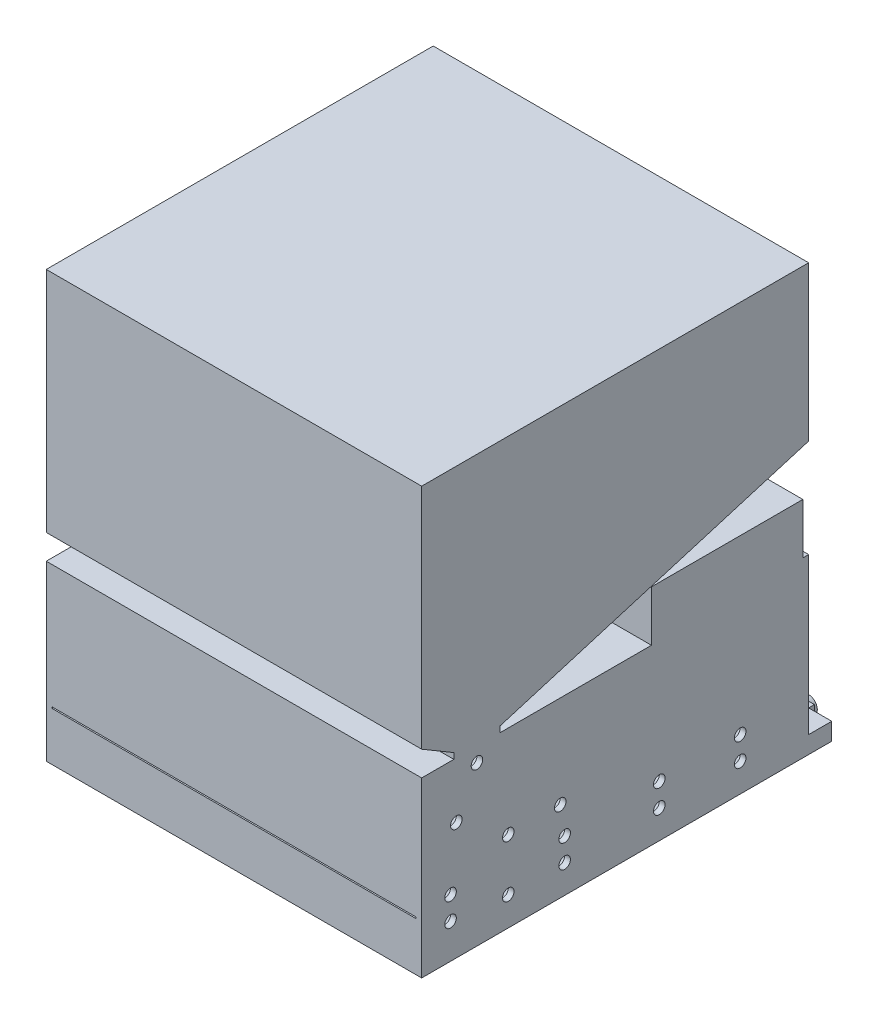
from build123d import *

# Parameters (mm, degrees)
SKETCH1_W            = 325
SKETCH1_H            = 335
BOSS_EXTRUDE1_DEPTH  = 150
SHELL3_T             = 5
CUT_EXTRUDE1_REACH   = 403.412
SKETCH2_W            = 315
SKETCH2_H            = 1.2
CUT_EXTRUDE2_REACH   = 397.198
SKETCH3_R            = 5
CUT_EXTRUDE3_REACH   = 279.421
SKETCH5_W            = 315
SKETCH5_H            = 40
BOSS_EXTRUDE2_REACH  = 393.096
BOSS_EXTRUDE17_REACH = 397.198
SHELL5_START         = -159.5
SHELL5_DEPTH         = 319
CUT_EXTRUDE6_START   = -5
SKETCH10_W           = 34.013733522
SKETCH10_H           = 3
CUT_EXTRUDE6_DEPTH   = 315
BOSS_EXTRUDE18_REACH = 521.286
BOSS_EXTRUDE21_START = -325
BOSS_EXTRUDE21_DEPTH = 325
SHELL6_START         = -159.5
SHELL6_DEPTH         = 319
SKETCH13_W           = 315
SKETCH13_H           = 61.573606594
CUT_EXTRUDE7_DEPTH   = 10
SKETCH14_W           = 325
SKETCH14_H           = 15
BOSS_EXTRUDE22_DEPTH = 20
SKETCH15_R           = 7.5
SKETCH15_R_2         = 5
BOSS_EXTRUDE23_DEPTH = 10
SKETCH16_W           = 20
SKETCH16_H           = 15
BOSS_EXTRUDE24_DEPTH = 5
SKETCH17_R           = 7.5
SKETCH17_R_2         = 5
BOSS_EXTRUDE25_DEPTH = 10
SKETCH18_W           = 20
SKETCH18_H           = 15
BOSS_EXTRUDE26_DEPTH = 5


# Read off the part's stored shape, not the designer's step: Shell5, Shell6
with BuildPart() as part:
    # Sketch1 → Boss-Extrude1 (new body)
    with BuildSketch(Plane(origin=(0, 0, 0), x_dir=(1, 0, 0), z_dir=(0, 1, 0))):
        Rectangle(SKETCH1_W, SKETCH1_H)
    extrude(amount=BOSS_EXTRUDE1_DEPTH)

    # Shell3 (no face opened: a closed hollow body)
    add(offset(amount=-SHELL3_T, mode=Mode.PRIVATE), mode=Mode.SUBTRACT)

    # Sketch2 → Cut-Extrude1 (cut, up to next)
    with BuildSketch(Plane.XY.offset(167.5), mode=Mode.PRIVATE) as cut_extrude1_sk1:
        with Locations((0, 42.7)):
            Rectangle(SKETCH2_W, SKETCH2_H)
    cut_extrude1_tool1 = extrude(cut_extrude1_sk1.sketch, amount=-CUT_EXTRUDE1_REACH, mode=Mode.PRIVATE) & part.part
    add(cut_extrude1_tool1.solids().sort_by_distance((0, 42.7, 167.5))[0], mode=Mode.SUBTRACT)

    # Cut-Extrude2: up to this face of the body (flat: up to its plane)
    cut_extrude2_end = Plane(part.part.faces().sort_by_distance((-162.5, 75, 0))[0])
    # Sketch3 → Cut-Extrude2 (cut, up to the picked face)
    with BuildSketch(Plane(origin=(162.5, 0, 0), x_dir=(0, 0, -1), z_dir=(1, 0, 0)), mode=Mode.PRIVATE) as cut_extrude2_sk1:
        with Locations((-92.5, 25)):
            Circle(SKETCH3_R)
    cut_extrude2_tool1 = split(extrude(cut_extrude2_sk1.sketch, amount=-CUT_EXTRUDE2_REACH, mode=Mode.PRIVATE), bisect_by=cut_extrude2_end, keep=Keep.BOTH, mode=Mode.PRIVATE)
    # Sketch3 → Cut-Extrude2 (cut, up to the picked face)
    with BuildSketch(Plane(origin=(162.5, 0, 0), x_dir=(0, 0, -1), z_dir=(1, 0, 0)), mode=Mode.PRIVATE) as cut_extrude2_sk2:
        with Locations((-92.5, 70)):
            Circle(SKETCH3_R)
    cut_extrude2_tool2 = split(extrude(cut_extrude2_sk2.sketch, amount=-CUT_EXTRUDE2_REACH, mode=Mode.PRIVATE), bisect_by=cut_extrude2_end, keep=Keep.BOTH, mode=Mode.PRIVATE)
    # Sketch3 → Cut-Extrude2 (cut, up to the picked face)
    with BuildSketch(Plane(origin=(162.5, 0, 0), x_dir=(0, 0, -1), z_dir=(1, 0, 0)), mode=Mode.PRIVATE) as cut_extrude2_sk3:
        with Locations((-137.5, 101.622776602)):
            Circle(SKETCH3_R)
    cut_extrude2_tool3 = split(extrude(cut_extrude2_sk3.sketch, amount=-CUT_EXTRUDE2_REACH, mode=Mode.PRIVATE), bisect_by=cut_extrude2_end, keep=Keep.BOTH, mode=Mode.PRIVATE)
    # Sketch3 → Cut-Extrude2 (cut, up to the picked face)
    with BuildSketch(Plane(origin=(162.5, 0, 0), x_dir=(0, 0, -1), z_dir=(1, 0, 0)), mode=Mode.PRIVATE) as cut_extrude2_sk4:
        with Locations((-119.658277141, 137.423236451)):
            Circle(SKETCH3_R)
    cut_extrude2_tool4 = split(extrude(cut_extrude2_sk4.sketch, amount=-CUT_EXTRUDE2_REACH, mode=Mode.PRIVATE), bisect_by=cut_extrude2_end, keep=Keep.BOTH, mode=Mode.PRIVATE)
    # Sketch3 → Cut-Extrude2 (cut, up to the picked face)
    with BuildSketch(Plane(origin=(162.5, 0, 0), x_dir=(0, 0, -1), z_dir=(1, 0, 0)), mode=Mode.PRIVATE) as cut_extrude2_sk5:
        with Locations((-47.500046324, 69.935430722)):
            Circle(SKETCH3_R)
    cut_extrude2_tool5 = split(extrude(cut_extrude2_sk5.sketch, amount=-CUT_EXTRUDE2_REACH, mode=Mode.PRIVATE), bisect_by=cut_extrude2_end, keep=Keep.BOTH, mode=Mode.PRIVATE)
    # Sketch3 → Cut-Extrude2 (cut, up to the picked face)
    with BuildSketch(Plane(origin=(162.5, 0, 0), x_dir=(0, 0, -1), z_dir=(1, 0, 0)), mode=Mode.PRIVATE) as cut_extrude2_sk6:
        with Locations((-142.5, 30)):
            Circle(SKETCH3_R)
    cut_extrude2_tool6 = split(extrude(cut_extrude2_sk6.sketch, amount=-CUT_EXTRUDE2_REACH, mode=Mode.PRIVATE), bisect_by=cut_extrude2_end, keep=Keep.BOTH, mode=Mode.PRIVATE)
    # Sketch3 → Cut-Extrude2 (cut, up to the picked face)
    with BuildSketch(Plane(origin=(162.5, 0, 0), x_dir=(0, 0, -1), z_dir=(1, 0, 0)), mode=Mode.PRIVATE) as cut_extrude2_sk7:
        with Locations((-142.5, 50)):
            Circle(SKETCH3_R)
    cut_extrude2_tool7 = split(extrude(cut_extrude2_sk7.sketch, amount=-CUT_EXTRUDE2_REACH, mode=Mode.PRIVATE), bisect_by=cut_extrude2_end, keep=Keep.BOTH, mode=Mode.PRIVATE)
    # Sketch3 → Cut-Extrude2 (cut, up to the picked face)
    with BuildSketch(Plane(origin=(162.5, 0, 0), x_dir=(0, 0, -1), z_dir=(1, 0, 0)), mode=Mode.PRIVATE) as cut_extrude2_sk8:
        with Locations((-43.722890718, 44.587530421)):
            Circle(SKETCH3_R)
    cut_extrude2_tool8 = split(extrude(cut_extrude2_sk8.sketch, amount=-CUT_EXTRUDE2_REACH, mode=Mode.PRIVATE), bisect_by=cut_extrude2_end, keep=Keep.BOTH, mode=Mode.PRIVATE)
    # Sketch3 → Cut-Extrude2 (cut, up to the picked face)
    with BuildSketch(Plane(origin=(162.5, 0, 0), x_dir=(0, 0, -1), z_dir=(1, 0, 0)), mode=Mode.PRIVATE) as cut_extrude2_sk9:
        with Locations((-43.722890718, 24.587530421)):
            Circle(SKETCH3_R)
    cut_extrude2_tool9 = split(extrude(cut_extrude2_sk9.sketch, amount=-CUT_EXTRUDE2_REACH, mode=Mode.PRIVATE), bisect_by=cut_extrude2_end, keep=Keep.BOTH, mode=Mode.PRIVATE)
    # Sketch3 → Cut-Extrude2 (cut, up to the picked face)
    with BuildSketch(Plane(origin=(162.5, 0, 0), x_dir=(0, 0, -1), z_dir=(1, 0, 0)), mode=Mode.PRIVATE) as cut_extrude2_sk10:
        with Locations((38.216214767, 44.587530421)):
            Circle(SKETCH3_R)
    cut_extrude2_tool10 = split(extrude(cut_extrude2_sk10.sketch, amount=-CUT_EXTRUDE2_REACH, mode=Mode.PRIVATE), bisect_by=cut_extrude2_end, keep=Keep.BOTH, mode=Mode.PRIVATE)
    # Sketch3 → Cut-Extrude2 (cut, up to the picked face)
    with BuildSketch(Plane(origin=(162.5, 0, 0), x_dir=(0, 0, -1), z_dir=(1, 0, 0)), mode=Mode.PRIVATE) as cut_extrude2_sk11:
        with Locations((38.216214767, 24.587530421)):
            Circle(SKETCH3_R)
    cut_extrude2_tool11 = split(extrude(cut_extrude2_sk11.sketch, amount=-CUT_EXTRUDE2_REACH, mode=Mode.PRIVATE), bisect_by=cut_extrude2_end, keep=Keep.BOTH, mode=Mode.PRIVATE)
    # Sketch3 → Cut-Extrude2 (cut, up to the picked face)
    with BuildSketch(Plane(origin=(162.5, 0, 0), x_dir=(0, 0, -1), z_dir=(1, 0, 0)), mode=Mode.PRIVATE) as cut_extrude2_sk12:
        with Locations((108.24046589, 44.587530421)):
            Circle(SKETCH3_R)
    cut_extrude2_tool12 = split(extrude(cut_extrude2_sk12.sketch, amount=-CUT_EXTRUDE2_REACH, mode=Mode.PRIVATE), bisect_by=cut_extrude2_end, keep=Keep.BOTH, mode=Mode.PRIVATE)
    # Sketch3 → Cut-Extrude2 (cut, up to the picked face)
    with BuildSketch(Plane(origin=(162.5, 0, 0), x_dir=(0, 0, -1), z_dir=(1, 0, 0)), mode=Mode.PRIVATE) as cut_extrude2_sk13:
        with Locations((108.24046589, 24.587530421)):
            Circle(SKETCH3_R)
    cut_extrude2_tool13 = split(extrude(cut_extrude2_sk13.sketch, amount=-CUT_EXTRUDE2_REACH, mode=Mode.PRIVATE), bisect_by=cut_extrude2_end, keep=Keep.BOTH, mode=Mode.PRIVATE)
    add(cut_extrude2_tool1.solids().sort_by(Axis((162.5, 25, 92.5), (-1, 0, 0)))[0], mode=Mode.SUBTRACT)
    add(cut_extrude2_tool2.solids().sort_by(Axis((162.5, 70, 92.5), (-1, 0, 0)))[0], mode=Mode.SUBTRACT)
    add(cut_extrude2_tool3.solids().sort_by(Axis((162.5, 101.622777, 137.5), (-1, 0, 0)))[0], mode=Mode.SUBTRACT)
    add(cut_extrude2_tool4.solids().sort_by(Axis((162.5, 137.423236, 119.658277), (-1, 0, 0)))[0], mode=Mode.SUBTRACT)
    add(cut_extrude2_tool5.solids().sort_by(Axis((162.5, 69.935431, 47.500046), (-1, 0, 0)))[0], mode=Mode.SUBTRACT)
    add(cut_extrude2_tool6.solids().sort_by(Axis((162.5, 30, 142.5), (-1, 0, 0)))[0], mode=Mode.SUBTRACT)
    add(cut_extrude2_tool7.solids().sort_by(Axis((162.5, 50, 142.5), (-1, 0, 0)))[0], mode=Mode.SUBTRACT)
    add(cut_extrude2_tool8.solids().sort_by(Axis((162.5, 44.58753, 43.722891), (-1, 0, 0)))[0], mode=Mode.SUBTRACT)
    add(cut_extrude2_tool9.solids().sort_by(Axis((162.5, 24.58753, 43.722891), (-1, 0, 0)))[0], mode=Mode.SUBTRACT)
    add(cut_extrude2_tool10.solids().sort_by(Axis((162.5, 44.58753, -38.216215), (-1, 0, 0)))[0], mode=Mode.SUBTRACT)
    add(cut_extrude2_tool11.solids().sort_by(Axis((162.5, 24.58753, -38.216215), (-1, 0, 0)))[0], mode=Mode.SUBTRACT)
    add(cut_extrude2_tool12.solids().sort_by(Axis((162.5, 44.58753, -108.240466), (-1, 0, 0)))[0], mode=Mode.SUBTRACT)
    add(cut_extrude2_tool13.solids().sort_by(Axis((162.5, 24.58753, -108.240466), (-1, 0, 0)))[0], mode=Mode.SUBTRACT)

    # Sketch5 → Cut-Extrude3 (cut, up to next)
    with BuildSketch(Plane(origin=(0, 150, 0), x_dir=(1, 0, 0), z_dir=(0, 1, 0)), mode=Mode.PRIVATE) as cut_extrude3_sk1:
        with Locations((0, -119.66)):
            Rectangle(SKETCH5_W, SKETCH5_H)
    cut_extrude3_tool1 = extrude(cut_extrude3_sk1.sketch, amount=-CUT_EXTRUDE3_REACH, mode=Mode.PRIVATE) & part.part
    add(cut_extrude3_tool1.solids().sort_by_distance((0, 150, 119.66))[0], mode=Mode.SUBTRACT)

    # Sketch6 → Boss-Extrude2 (add, up to next)
    with BuildSketch(Plane(origin=(-157.5, 0, 0), x_dir=(0, 0, -1), z_dir=(1, 0, 0)), mode=Mode.PRIVATE) as boss_extrude2_sk1:
        Polygon((-139.66, 145), (-139.66, 150), (-138.231714314, 145), align=None)
    boss_extrude2_tool1 = extrude(boss_extrude2_sk1.sketch, amount=BOSS_EXTRUDE2_REACH, mode=Mode.PRIVATE) - part.part
    add(boss_extrude2_tool1.solids().sort_by_distance((-157.5, 146.666667, 139.183905))[0])

    # Boss-Extrude17: up to this face of the body (flat: up to its plane)
    boss_extrude17_end = Plane(part.part.faces().sort_by_distance((-162.5, 75.45228474, -0.908085731))[0])
    # Sketch8 → Boss-Extrude17 (add, up to the picked face)
    with BuildSketch(Plane(origin=(162.5, 0, 0), x_dir=(0, 0, -1), z_dir=(1, 0, 0)), mode=Mode.PRIVATE) as boss_extrude17_sk1:
        Polygon((-139.66, 150), (-139.66, 155.069916887), (-167.5, 171.535366128), (-167.5, 368.750208138), (167.5, 368.750208138), (167.5, 235.038446244), (-99.66, 155.069916887), (-99.66, 148.202053203), (-139.66, 148.202053203), align=None)
    boss_extrude17_tool1 = split(extrude(boss_extrude17_sk1.sketch, amount=-BOSS_EXTRUDE17_REACH, mode=Mode.PRIVATE), bisect_by=boss_extrude17_end, keep=Keep.BOTH, mode=Mode.PRIVATE)
    add(boss_extrude17_tool1.solids().sort_by(Axis((162.5, 275.848199, 13.693896), (-1, 0, 0)))[0])

    # Shell5 outline → Shell5 (cut)
    with BuildSketch(Plane.YZ.offset(SHELL5_START)):
        Polygon((156.781038051, 136.66), (151.202053203, 136.66), (151.202053203, 102.66), (157.303445655, 102.66), (237.271975012, -164.5), (365.750208138, -164.5), (365.750208138, 164.5), (173.246487291, 164.5), align=None)
    extrude(amount=SHELL5_DEPTH, mode=Mode.SUBTRACT)

    # Sketch10 → Cut-Extrude6 (cut)
    with BuildSketch(Plane.ZY.offset(162.5).offset(CUT_EXTRUDE6_START)):
        with Locations((119.666866761, 149.702053203)):
            Rectangle(SKETCH10_W, SKETCH10_H)
    extrude(amount=-CUT_EXTRUDE6_DEPTH, mode=Mode.SUBTRACT)

    # Sketch11 → Boss-Extrude18 (add, up to next)
    with BuildSketch(Plane(origin=(162.5, 0, 0), x_dir=(0, 0, -1), z_dir=(1, 0, 0)), mode=Mode.PRIVATE) as boss_extrude18_sk1:
        Polygon((6.029897086, 59.502538782), (-1.041170726, 66.573606594), (-8.112238538, 59.502538782), (-1.041170726, 52.43147097), align=None)
    boss_extrude18_tool1 = extrude(boss_extrude18_sk1.sketch, amount=-BOSS_EXTRUDE18_REACH, mode=Mode.PRIVATE) - part.part
    # Sketch11 → Boss-Extrude18 (add, up to next)
    with BuildSketch(Plane(origin=(162.5, 0, 0), x_dir=(0, 0, -1), z_dir=(1, 0, 0)), mode=Mode.PRIVATE) as boss_extrude18_sk2:
        Polygon((8.654294126, 94.106372435), (-8.403020832, 88.72181715), (4.788798312, 76.642026718), align=None)
    boss_extrude18_tool2 = extrude(boss_extrude18_sk2.sketch, amount=-BOSS_EXTRUDE18_REACH, mode=Mode.PRIVATE) - part.part
    add(boss_extrude18_tool1.solids().sort_by_distance((162.5, 59.502539, 1.041171))[0])
    add(boss_extrude18_tool2.solids().sort_by_distance((162.5, 86.490072, -1.680024))[0])

    # Sketch12 → Boss-Extrude21 (add)
    with BuildSketch(Plane(origin=(162.5, 0, 0), x_dir=(0, 0, -1), z_dir=(1, 0, 0)).offset(BOSS_EXTRUDE21_START)):
        Polygon((31.42, 193.804048752), (31.42, 89.309053326), (162.5, 62.804048752), (162.5, 193.804048752), align=None)
    extrude(amount=BOSS_EXTRUDE21_DEPTH)

    # Shell6 outline → Shell6 (cut)
    with BuildSketch(Plane.YZ.offset(SHELL6_START)):
        Polygon((65.46035493, -164.5), (147, -164.5), (147, -159.5), (190.804048752, -159.5), (190.804048752, -34.42), (91.763154708, -34.42), align=None)
        Polygon((56.674111657, 1.041170726), (59.502538782, -1.787256399), (62.330965907, 1.041170726), (59.502538782, 3.86959785), align=None)
        Polygon((87.425179874, 2.544801668), (82.363711973, -2.98260955), (89.681324456, -4.602263724), align=None)
    extrude(amount=SHELL6_DEPTH, mode=Mode.SUBTRACT)

    # Sketch13 → Cut-Extrude7 (cut)
    with BuildSketch(Plane(origin=(0, 0, -167.5), x_dir=(-1, 0, 0), z_dir=(0, 0, -1))):
        with Locations((0, 35.786803297)):
            Rectangle(SKETCH13_W, SKETCH13_H)
    extrude(amount=-CUT_EXTRUDE7_DEPTH, mode=Mode.SUBTRACT)

    # Sketch14 → Boss-Extrude22 (add)
    with BuildSketch(Plane(origin=(0, 0, -167.5), x_dir=(-1, 0, 0), z_dir=(0, 0, -1))):
        with Locations((0, 7.5)):
            Rectangle(SKETCH14_W, SKETCH14_H)
    extrude(amount=BOSS_EXTRUDE22_DEPTH)

    # Sketch15 → Boss-Extrude23 (add)
    # profile 1 of 2: a face of its own
    with BuildSketch(Plane(origin=(0, 0, -187.5), x_dir=(-1, 0, 0), z_dir=(0, 0, -1))):
        with Locations(Location((132.5, 7.5, 0), (0, 0, 270))):
            Circle(SKETCH15_R)
        with Locations((132.5, 7.5)):
            Circle(SKETCH15_R_2, mode=Mode.SUBTRACT)
    # profile 2 of 2: a face of its own
    with BuildSketch(Plane(origin=(0, 0, -187.5), x_dir=(-1, 0, 0), z_dir=(0, 0, -1))):
        with Locations(Location((-132.5, 7.5, 0), (0, 0, 270))):
            Circle(SKETCH15_R)
        with Locations((-132.5, 7.5)):
            Circle(SKETCH15_R_2, mode=Mode.SUBTRACT)
    extrude(amount=BOSS_EXTRUDE23_DEPTH)

    # Sketch16 → Boss-Extrude24 (add)
    with BuildSketch(Plane(origin=(0, 0, -187.5), x_dir=(-1, 0, 0), z_dir=(0, 0, -1))):
        with Locations((-132.5, 7.5)):
            Rectangle(SKETCH16_W, SKETCH16_H)
        with Locations((132.5, 7.5)):
            Rectangle(SKETCH16_W, SKETCH16_H)
    extrude(amount=BOSS_EXTRUDE24_DEPTH)

    # Sketch17 → Boss-Extrude25 (add)
    with BuildSketch(Plane(origin=(0, 0, -187.5), x_dir=(-1, 0, 0), z_dir=(0, 0, -1))):
        with Locations(Location((0, 7.5, 0), (0, 0, 270))):
            Circle(SKETCH17_R)
        with Locations((0, 7.5)):
            Circle(SKETCH17_R_2, mode=Mode.SUBTRACT)
    extrude(amount=BOSS_EXTRUDE25_DEPTH)

    # Sketch18 → Boss-Extrude26 (add)
    with BuildSketch(Plane(origin=(0, 0, -187.5), x_dir=(-1, 0, 0), z_dir=(0, 0, -1))):
        with Locations((0, 7.5)):
            Rectangle(SKETCH18_W, SKETCH18_H)
    extrude(amount=BOSS_EXTRUDE26_DEPTH)


solid = part.part
